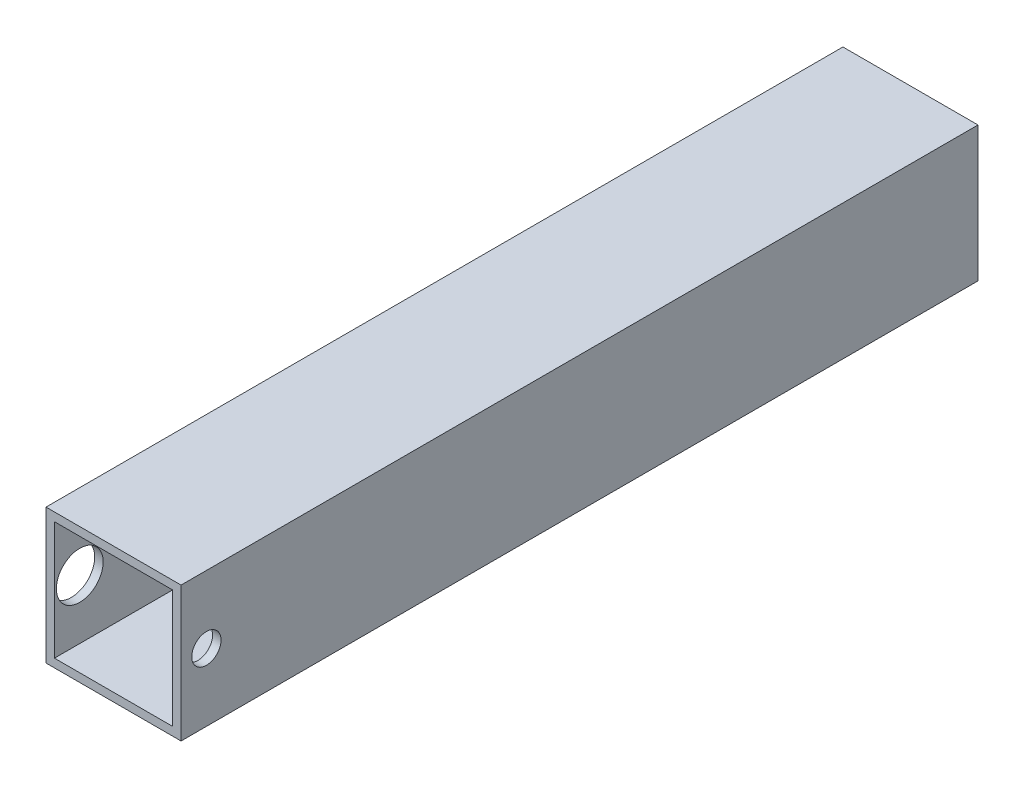
from build123d import *

# Parameters (mm, degrees)
SKETCH1_W                      = 25.4
SKETCH1_H                      = 25.4
BOSS_EXTRUDE1_DEPTH            = 74.93
SHELL1_T                       = -1.5875
CBORE_FOR_M5_SHCS1_D           = 5.5
CBORE_FOR_M5_SHCS1_CBORE_D     = 8.8
CBORE_FOR_M5_SHCS1_CBORE_DEPTH = 5


with BuildPart() as part:
    # Sketch1 → Boss-Extrude1 (new, symmetric)
    with BuildSketch(Plane.XY):
        Rectangle(SKETCH1_W, SKETCH1_H)
    extrude(amount=BOSS_EXTRUDE1_DEPTH, both=True)

    # Shell1
    shell1_openings = [part.faces().sort_by_distance(p)[0] for p in [
        (0, 0, -74.93),
        (0, 0, 74.93),
    ]]
    offset(amount=SHELL1_T, openings=shell1_openings, kind=Kind.INTERSECTION)

    # CBORE for M5 SHCS1 (through all)
    with Locations(Plane.ZY.offset(12.7)):
        with Locations((70.1675, 0)):
            CounterBoreHole(CBORE_FOR_M5_SHCS1_D / 2, CBORE_FOR_M5_SHCS1_CBORE_D / 2, CBORE_FOR_M5_SHCS1_CBORE_DEPTH)


solid = part.part
